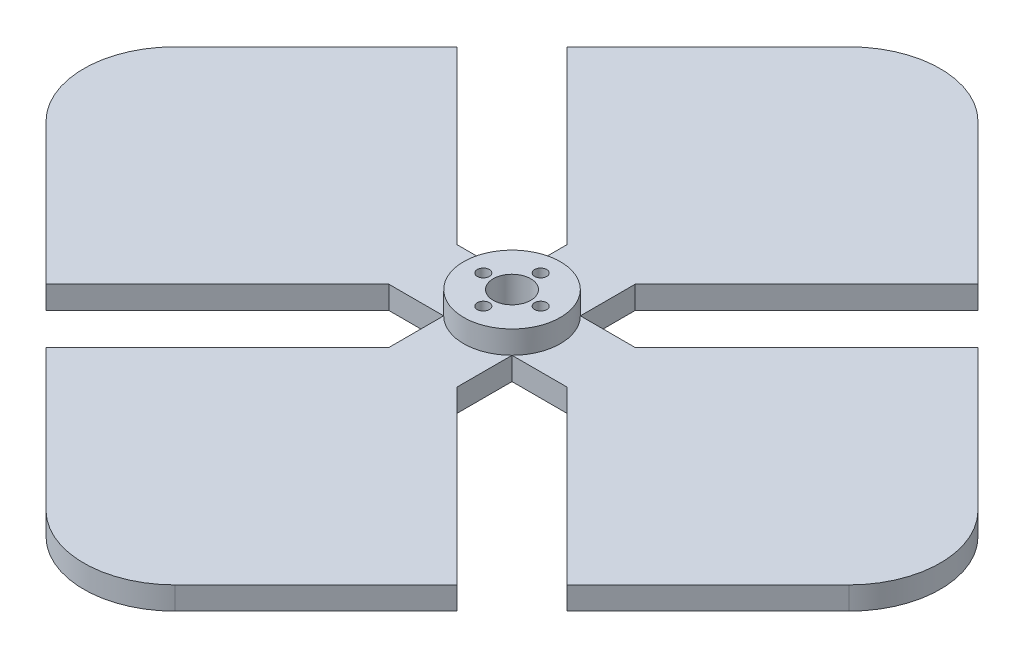
from build123d import *

# Parameters (mm, degrees)
BOSS_EXTRUDE5_DEPTH      = 6.35
FILLET1_R                = 25.4
CIRPATTERN7_COUNT        = 4
FILLET1_OF_CIRPATTERN7_R = 25.4
SKETCH13_R               = 13.470384182
BOSS_EXTRUDE8_DEPTH      = 6.35
SKETCH1_R                = 5.22699996
SKETCH1_R_2              = 1.686500056
CUT_EXTRUDE1_DEPTH       = 170.292478771


with BuildPart() as part:
    # Sketch4 → Boss-Extrude5 (new body)
    with BuildSketch(Plane(origin=(0, 0, 0), x_dir=(1, 0, 0), z_dir=(0, 1, 0))):
        Polygon((24.8285, 9.525), (0, 9.525), (0, -9.525), (24.8285, -9.525), (72.597534052, -57.294034052), (129.891568105, 0), (72.597534052, 57.294034052), align=None)
    boss_extrude5 = extrude(amount=BOSS_EXTRUDE5_DEPTH)

    # Fillet1
    fillet1_edges = [part.edges().sort_by_distance(p)[0] for p in [
        (129.891568105, 3.175, 0),
    ]]
    fillet(fillet1_edges, radius=FILLET1_R)

    # CirPattern7: Boss-Extrude5 ×4 about axis
    cirpattern7_axis = Axis((0, 0, 0), (0, 1, 0))
    for i in range(1, CIRPATTERN7_COUNT):
        add(boss_extrude5.rotate(cirpattern7_axis, i * 360 / CIRPATTERN7_COUNT))

    # Fillet1 of CirPattern7
    fillet1_of_cirpattern7_edges = [part.edges().sort_by_distance(p)[0] for p in [
        (0, 3.175, -129.891568105),
        (-129.891568105, 3.175, 0),
        (0, 3.175, 129.891568105),
    ]]
    fillet(fillet1_of_cirpattern7_edges, radius=FILLET1_OF_CIRPATTERN7_R)

    # Sketch13 → Boss-Extrude8 (add)
    with BuildSketch(Plane(origin=(0, 6.35, 0), x_dir=(1, 0, 0), z_dir=(0, 1, 0))):
        Circle(SKETCH13_R)
    extrude(amount=BOSS_EXTRUDE8_DEPTH)

    # Sketch1 → Cut-Extrude1 (cut, through all)
    with BuildSketch(Plane(origin=(0, 0, 0), x_dir=(1, 0, 0), z_dir=(0, 1, 0))):
        Circle(SKETCH1_R)
        with Locations((8.000000002, 0)):
            Circle(SKETCH1_R_2)
        with Locations((0, -8.000000002)):
            Circle(SKETCH1_R_2)
        with Locations((-8.000000002, 0)):
            Circle(SKETCH1_R_2)
        with Locations((0, 8.000000002)):
            Circle(SKETCH1_R_2)
    extrude(amount=CUT_EXTRUDE1_DEPTH, mode=Mode.SUBTRACT)


solid = part.part
